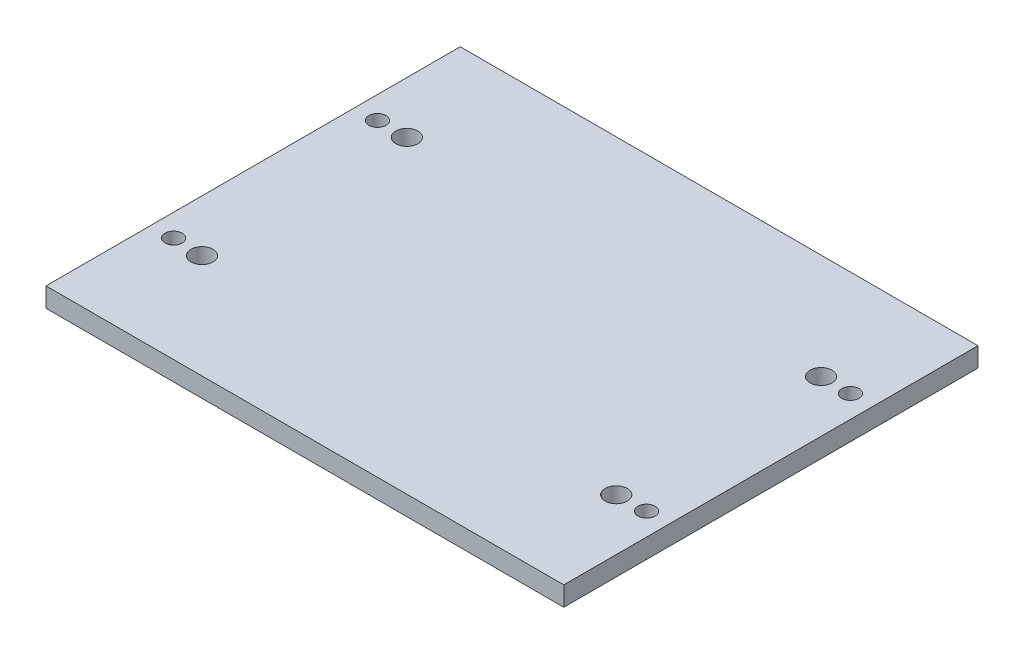
from build123d import *

# Parameters (mm, degrees)
SKETCH1_W               = 127
SKETCH1_H               = 101.6
BOSS_EXTRUDE1_DEPTH     = 4.7625
M5X0_8_TAPPED_HOLE1_D   = 4.2
F_1_4_28_TAPPED_HOLE1_D = 5.4102


with BuildPart() as part:
    # Sketch1 → Boss-Extrude1 (new body)
    with BuildSketch(Plane(origin=(0, 0, 0), x_dir=(1, 0, 0), z_dir=(0, 1, 0))):
        Rectangle(SKETCH1_W, SKETCH1_H)
    extrude(amount=BOSS_EXTRUDE1_DEPTH)

    # M5x0.8 Tapped Hole1 (through all)
    with Locations(Plane(origin=(0, 4.7625, 0), x_dir=(1, 0, 0), z_dir=(0, 1, 0))):
        with Locations((-58, 25), (58, 25), (58, -25), (-58, -25)):
            Hole(M5X0_8_TAPPED_HOLE1_D / 2)

    # 1/4-28 Tapped Hole1 (through all)
    with Locations(Plane(origin=(0, 0, 0), x_dir=(-1, 0, 0), z_dir=(0, -1, 0))):
        with Locations((-50.8, 25), (50.8, 25), (50.8, -25.2375), (-50.8, -25.2375)):
            Hole(F_1_4_28_TAPPED_HOLE1_D / 2)


solid = part.part
